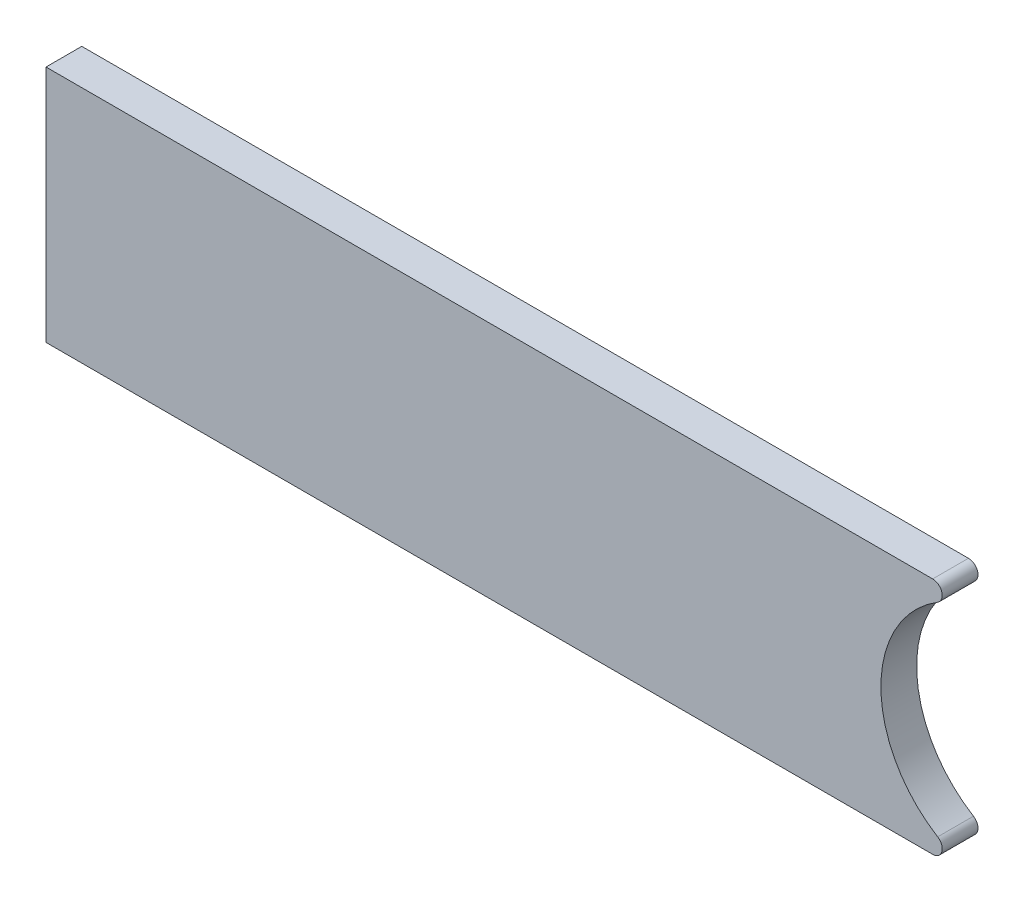
from build123d import *

# Parameters (mm, degrees)
ESBO_O1_W                = 80
ESBO_O1_H                = 20
RESSALTO_EXTRUS_O1_DEPTH = 3
ESBO_O2_R                = 10
CORTE_EXTRUS_O1_DEPTH    = 10
FILETE1_R                = 0.8
FILETE2_R                = 0.8


with BuildPart() as part:
    # Esboço1 → Ressalto-extrusão1 (new body)
    with BuildSketch(Plane.XY):
        with Locations((-5.941010257, 18.311759729)):
            Rectangle(ESBO_O1_W, ESBO_O1_H)
    extrude(amount=RESSALTO_EXTRUS_O1_DEPTH)

    # Esboço2 → Corte-extrusão1 (cut)
    with BuildSketch(Plane.XY.offset(3)):
        with Locations((34.058989743, 18.311759729)):
            Circle(ESBO_O2_R)
    extrude(amount=-CORTE_EXTRUS_O1_DEPTH, mode=Mode.SUBTRACT)

    # Filete1
    filete1_edges = [part.edges().sort_by_distance(p)[0] for p in [
        (34.058989743, 28.311759729, 1.5),
    ]]
    fillet(filete1_edges, radius=FILETE1_R)

    # Filete2
    # the kernel refuses this fillet: 0.8 mm, written as the material it takes off along each edge
    with BuildSketch(Plane(origin=(34.058989743, 8.311759729, -14.142135624), x_dir=(-0.9622504486493761, 0.2721655269759089, 0), z_dir=(0, 0, 1))) as filete2_piece_1:
        with BuildLine():
            CenterArc((5.661042961, 0.769800359), FILETE2_R, 105.793169048, 148.413661903)
            Line((5.44331054, 1.539600718), (0, 0))
            ThreePointArc((0, 0), (2.72165527, 0.377495514), (5.44331054, 0))
        make_face()
    extrude(amount=31.284271247, mode=Mode.SUBTRACT)


solid = part.part
